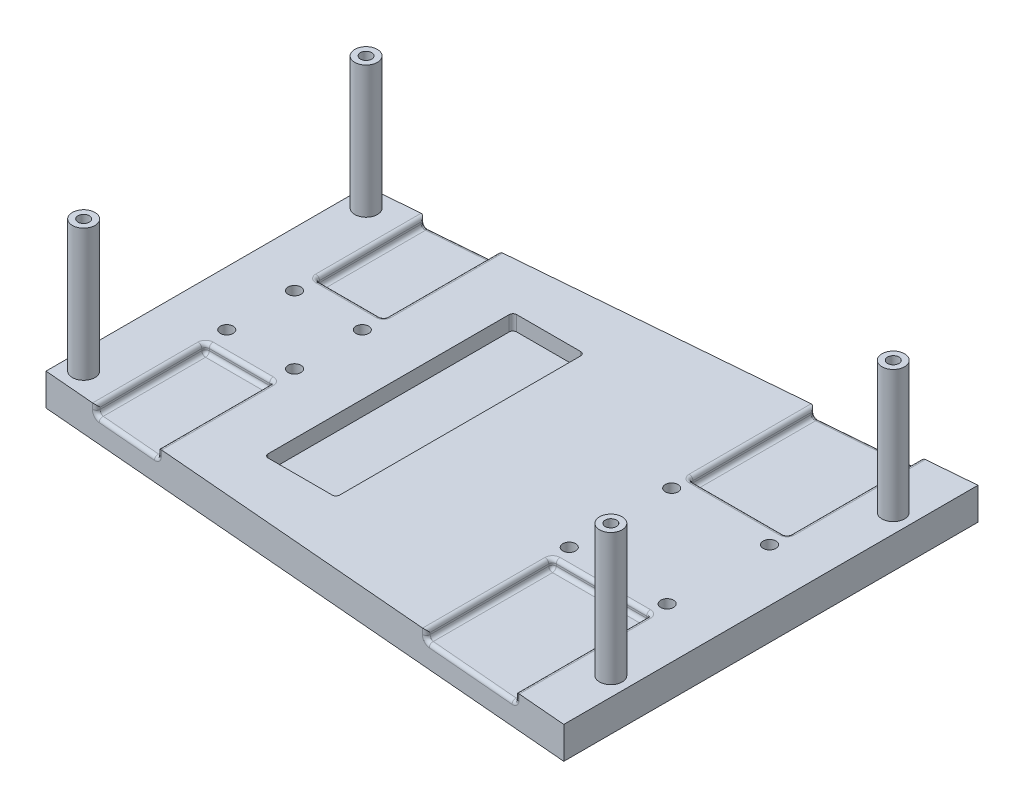
from build123d import *

# Parameters (mm, degrees)
BOSS_EXTRUDE1_DEPTH                             = 8.5
F_3_0MM_DOWEL_HOLE2_D                           = 3
SKETCH5_R                                       = 3
BOSS_EXTRUDE2_DEPTH                             = 35
F_3_0MM_DOWEL_HOLE1_D                           = 3
F_3_0MM_DOWEL_HOLE1_DEPTH                       = 15
F_3_0MM_DOWEL_HOLE1_TIP                         = 0.901290929
CSK_FOR_M3_FLAT_HEAD_MACHINE_SCREW1_D           = 3.4
CSK_FOR_M3_FLAT_HEAD_MACHINE_SCREW1_CSINK_D     = 6.3
CSK_FOR_M3_FLAT_HEAD_MACHINE_SCREW1_CSINK_ANGLE = 90
CUT_EXTRUDE1_DEPTH                              = 2.5
FILLET2_R                                       = 1
FILLET3_R                                       = 1
FILLET4_R                                       = 1
FILLET5_R                                       = 1
CUT_EXTRUDE2_DEPTH                              = 4


with BuildPart() as part:
    # Sketch1 → Boss-Extrude1 (new body)
    with BuildSketch(Plane(origin=(0, 0, 0), x_dir=(1, 0, 0), z_dir=(0, 1, 0))):
        Polygon((-75, -42.5), (-75, 42.5), (75, 55), (75, -55), align=None)
    extrude(amount=BOSS_EXTRUDE1_DEPTH)

    # Ø3.0mm Dowel Hole2 (through all)
    with Locations(Plane(origin=(0, 8.5, 0), x_dir=(1, 0, 0), z_dir=(0, 1, 0))):
        with Locations((-60.5, -9), (-60.5, 9), (-42.5, 9), (-42.5, -9), (35, -13.55), (35, 13.65), (61, 13.65), (61, -13.55)):
            Hole(F_3_0MM_DOWEL_HOLE2_D / 2)

    # Sketch5 → Boss-Extrude2 (add)
    with BuildSketch(Plane(origin=(0, 8.5, 0), x_dir=(1, 0, 0), z_dir=(0, 1, 0))):
        with Locations((70, 37.5)):
            Circle(SKETCH5_R)
        with Locations((70, -37.5)):
            Circle(SKETCH5_R)
        with Locations((-70, -37.5)):
            Circle(SKETCH5_R)
        with Locations((-70, 37.5)):
            Circle(SKETCH5_R)
    extrude(amount=BOSS_EXTRUDE2_DEPTH)

    # Ø3.0mm Dowel Hole1
    with Locations(Plane(origin=(0, 43.5, 0), x_dir=(1, 0, 0), z_dir=(0, 1, 0))):
        with Locations((-70, -37.5), (-70, 37.5), (70, 37.5), (70, -37.5)):
            Hole(F_3_0MM_DOWEL_HOLE1_D / 2, depth=F_3_0MM_DOWEL_HOLE1_DEPTH)
            with Locations((0, 0, -(F_3_0MM_DOWEL_HOLE1_DEPTH + F_3_0MM_DOWEL_HOLE1_TIP / 2))):  # 118° drill point
                Cone(0, F_3_0MM_DOWEL_HOLE1_D / 2, F_3_0MM_DOWEL_HOLE1_TIP, mode=Mode.SUBTRACT)

    # CSK for M3 Flat Head Machine Screw1 (through all)
    with Locations(Plane(origin=(0, 0, 0), x_dir=(-1, 0, 0), z_dir=(0, -1, 0))):
        with Locations((42.5, 9), (60.5, -9), (60.5, 9), (42.5, -9), (-35, 13.65), (-35, -13.55), (-61, -13.55), (-61, 13.65)):
            CounterSinkHole(CSK_FOR_M3_FLAT_HEAD_MACHINE_SCREW1_D / 2, CSK_FOR_M3_FLAT_HEAD_MACHINE_SCREW1_CSINK_D / 2, counter_sink_angle=CSK_FOR_M3_FLAT_HEAD_MACHINE_SCREW1_CSINK_ANGLE)

    # Sketch11 → Cut-Extrude1 (cut)
    with BuildSketch(Plane(origin=(0, 8.5, 0), x_dir=(1, 0, 0), z_dir=(0, 1, 0))):
        Polygon((61.103115252, -18.091926271), (35.103115252, -18.091926271), (35.103115252, -51.675259604), (61.103115252, -53.841926271), align=None)
        Polygon((61.102905268, 18.180344146), (35.102905268, 18.180344146), (35.103573114, 51.67529776), (61.107132408, 53.842261034), align=None)
        Polygon((-42.5, 14.633566978), (-60.5, 14.633566978), (-60.500893046, 43.708258913), (-42.5, 45.208333333), align=None)
        Polygon((-60.5, -14.633566978), (-42.5, -14.633566978), (-42.5, -45.208333333), (-60.5, -43.708333333), align=None)
    extrude(amount=-CUT_EXTRUDE1_DEPTH, mode=Mode.SUBTRACT)

    # Fillet2
    fillet2_edges = [part.edges().sort_by_distance(p)[0] for p in [
        (-51.5, 8.5, -14.633566978),
        (-51.500446523, 6, -44.458296123),
        (-60.500893046, 7.25, -43.708258913),
        (-60.500446523, 6, -29.170912946),
        (-60.5, 7.25, -14.633566978),
        (-60.500446523, 8.5, -29.170912946),
        (-42.5, 7.25, -14.633566978),
        (-42.5, 6, -29.920950156),
        (-42.5, 7.25, -45.208333333),
        (-42.5, 8.5, -29.920950156),
    ]]
    fillet(fillet2_edges, radius=FILLET2_R)

    # Fillet3
    fillet3_edges = [part.edges().sort_by_distance(p)[0] for p in [
        (-51.5, 6, 44.458333333),
        (-60.5, 6, 29.170950156),
        (-60.5, 7.25, 43.708333333),
        (-60.5, 8.5, 29.170950156),
        (-51.5, 6, 14.633566978),
        (-60.5, 7.25, 14.633566978),
        (-51.5, 8.5, 14.633566978),
        (-42.5, 7.25, 45.208333333),
        (-42.5, 6, 29.920950156),
        (-42.5, 7.25, 14.633566978),
        (-42.5, 8.5, 29.920950156),
    ]]
    fillet(fillet3_edges, radius=FILLET3_R)

    # Fillet4
    fillet4_edges = [part.edges().sort_by_distance(p)[0] for p in [
        (48.105352761, 6, -52.758779397),
        (48.102905268, 8.5, -18.180344146),
        (35.103573114, 7.25, -51.67529776),
        (35.103239191, 6, -34.927820953),
        (35.102905268, 7.25, -18.180344146),
        (35.103239191, 8.5, -34.927820953),
        (48.102905268, 6, -18.180344146),
        (61.102905268, 7.25, -18.180344146),
        (61.105018838, 6, -36.01130259),
        (61.107132408, 7.25, -53.842261034),
        (61.105018838, 8.5, -36.01130259),
    ]]
    fillet(fillet4_edges, radius=FILLET4_R)

    # Fillet5
    fillet5_edges = [part.edges().sort_by_distance(p)[0] for p in [
        (48.103115252, 6, 52.758592938),
        (35.103115252, 6, 34.883592938),
        (35.103115252, 7.25, 51.675259604),
        (35.103115252, 8.5, 34.883592938),
        (61.103115252, 7.25, 53.841926271),
        (61.103115252, 6, 35.966926271),
        (61.103115252, 8.5, 35.966926271),
        (61.103115252, 7.25, 18.091926271),
        (48.103115252, 6, 18.091926271),
        (35.103115252, 7.25, 18.091926271),
        (48.103115252, 8.5, 18.091926271),
    ]]
    fillet(fillet5_edges, radius=FILLET5_R)

    # Sketch12 → Cut-Extrude2 (cut)
    with BuildSketch(Plane(origin=(0, 8.5, 0), x_dir=(1, 0, 0), z_dir=(0, 1, 0))):
        with BuildLine():
            Line((-25.5, 33), (-8.5, 33))
            ThreePointArc((-8.5, 33), (-7.792893219, 32.707106781), (-7.5, 32))
            Line((-7.5, 32), (-7.5, -32))
            ThreePointArc((-7.5, -32), (-7.792893219, -32.707106781), (-8.5, -33))
            Line((-8.5, -33), (-25.5, -33))
            ThreePointArc((-25.5, -33), (-26.207106781, -32.707106781), (-26.5, -32))
            Line((-26.5, -32), (-26.5, 32))
            ThreePointArc((-26.5, 32), (-26.207106781, 32.707106781), (-25.5, 33))
        make_face()
    extrude(amount=-CUT_EXTRUDE2_DEPTH, mode=Mode.SUBTRACT)


solid = part.part
